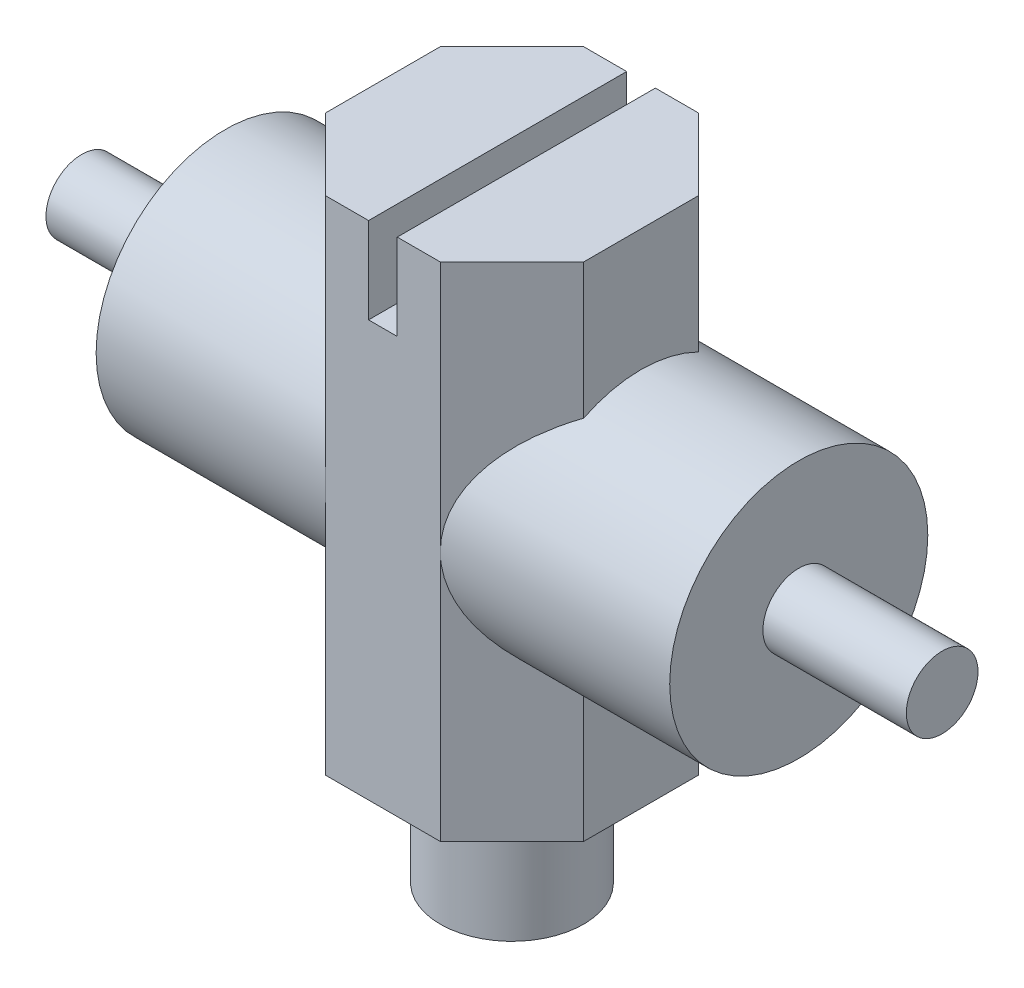
from build123d import *

# Parameters (mm, degrees)
SKETCH4_W           = 180
SKETCH4_H           = 180
BOSS_EXTRUDE2_DEPTH = 175
SKETCH5_R           = 50
BOSS_EXTRUDE3_DEPTH = 90
CHAMFER1_SIZE       = 50
SKETCH6_W           = 20
SKETCH6_H           = 180
CUT_EXTRUDE1_DEPTH  = 60


with BuildPart() as part:
    # Sketch3 → Revolve1 (revolve)
    with BuildSketch(Plane.XY, mode=Mode.PRIVATE) as revolve1_sk:
        Polygon((0, 0), (0, 25), (100, 25), (100, 90), (500, 90), (500, 25), (600, 25), (600, 0), align=None)
    revolve(revolve1_sk.sketch.rotate(Axis((0, 0, 0), (-1, 0, 0)), 90), axis=Axis((0, 0, 0), (-1, 0, 0)))

    # Sketch4 → Boss-Extrude2 (add, symmetric)
    with BuildSketch(Plane(origin=(0, 0, 0), x_dir=(1, 0, 0), z_dir=(0, 1, 0))):
        with Locations((300, 0)):
            Rectangle(SKETCH4_W, SKETCH4_H)
    extrude(amount=BOSS_EXTRUDE2_DEPTH, both=True)

    # Sketch5 → Boss-Extrude3 (add)
    with BuildSketch(Plane.XZ.offset(175)):
        with Locations(Location((300, 0, 0), (0, 0, 90))):
            Circle(SKETCH5_R)
    extrude(amount=BOSS_EXTRUDE3_DEPTH)

    # Chamfer1
    # the kernel refuses this chamfer: 50 mm, written as the material it takes off along each edge
    with BuildSketch(Plane(origin=(210, -303.584149398, -90), x_dir=(-0.027495876610586594, 0, 0.9996219169112966), z_dir=(0, 1, 0))) as chamfer1_piece_1_section:
        Polygon((CHAMFER1_SIZE * 0.999621916911, CHAMFER1_SIZE * 0.0274958766106), (-CHAMFER1_SIZE * 0.0274958766106, CHAMFER1_SIZE * 0.999621916911), (0, 0), align=None)
    chamfer1_piece_1 = extrude(amount=303.584149398, mode=Mode.PRIVATE)
    chamfer1_piece_1 = chamfer1_piece_1 - Plane(origin=(227.472268945, 0, 0), x_dir=(0, 0, -1), z_dir=(1, 0, 0)) * Cylinder(90, 808, mode=Mode.PRIVATE)
    add(chamfer1_piece_1, mode=Mode.SUBTRACT)
    with BuildSketch(Plane(origin=(210, -303.584149398, 90), x_dir=(-0.027495876610586598, 0, -0.9996219169112966), z_dir=(0, 1, 0))) as chamfer1_piece_2_section:
        Polygon((CHAMFER1_SIZE * 0.999621916911, -CHAMFER1_SIZE * 0.0274958766106), (-CHAMFER1_SIZE * 0.0274958766106, -CHAMFER1_SIZE * 0.999621916911), (0, 0), align=None)
    chamfer1_piece_2 = extrude(amount=303.584149398, mode=Mode.PRIVATE)
    chamfer1_piece_2 = chamfer1_piece_2 - Plane(origin=(227.472268938, 0, 0), x_dir=(0, 0, -1), z_dir=(1, 0, 0)) * Cylinder(90, 808, mode=Mode.PRIVATE)
    add(chamfer1_piece_2, mode=Mode.SUBTRACT)
    with BuildSketch(Plane(origin=(390, 0, 90), x_dir=(-0.9996219169112966, 0, 0.02749587661058631), z_dir=(0, -1, 0))) as chamfer1_piece_3_section:
        Polygon((CHAMFER1_SIZE * 0.999621916911, CHAMFER1_SIZE * 0.0274958766106), (-CHAMFER1_SIZE * 0.0274958766106, CHAMFER1_SIZE * 0.999621916911), (0, 0), align=None)
    chamfer1_piece_3 = extrude(amount=303.584149398, mode=Mode.PRIVATE)
    chamfer1_piece_3 = chamfer1_piece_3 - Plane(origin=(372.527731062, 0, 0), x_dir=(0, 0, -1), z_dir=(1, 0, 0)) * Cylinder(90, 808, mode=Mode.PRIVATE)
    add(chamfer1_piece_3, mode=Mode.SUBTRACT)
    with BuildSketch(Plane(origin=(390, 303.584149398, -90), x_dir=(-0.9996219169112966, 0, -0.02749587661058631), z_dir=(0, -1, 0))) as chamfer1_piece_4_section:
        Polygon((CHAMFER1_SIZE * 0.999621916911, -CHAMFER1_SIZE * 0.0274958766106), (-CHAMFER1_SIZE * 0.0274958766106, -CHAMFER1_SIZE * 0.999621916911), (0, 0), align=None)
    chamfer1_piece_4 = extrude(amount=303.584149398, mode=Mode.PRIVATE)
    chamfer1_piece_4 = chamfer1_piece_4 - Plane(origin=(372.527731055, 0, 0), x_dir=(0, 0, -1), z_dir=(1, 0, 0)) * Cylinder(90, 808, mode=Mode.PRIVATE)
    add(chamfer1_piece_4, mode=Mode.SUBTRACT)
    with BuildSketch(Plane(origin=(210, 0, -90), x_dir=(-0.027495876610586594, 0, 0.9996219169112966), z_dir=(0, 1, 0))) as chamfer1_piece_5_section:
        Polygon((CHAMFER1_SIZE * 0.999621916911, CHAMFER1_SIZE * 0.0274958766106), (-CHAMFER1_SIZE * 0.0274958766106, CHAMFER1_SIZE * 0.999621916911), (0, 0), align=None)
    chamfer1_piece_5 = extrude(amount=303.584149398, mode=Mode.PRIVATE)
    chamfer1_piece_5 = chamfer1_piece_5 - Plane(origin=(227.472268945, 0, 0), x_dir=(0, 0, -1), z_dir=(1, 0, 0)) * Cylinder(90, 808, mode=Mode.PRIVATE)
    add(chamfer1_piece_5, mode=Mode.SUBTRACT)
    with BuildSketch(Plane(origin=(210, 0, 90), x_dir=(-0.027495876610586598, 0, -0.9996219169112966), z_dir=(0, 1, 0))) as chamfer1_piece_6_section:
        Polygon((CHAMFER1_SIZE * 0.999621916911, -CHAMFER1_SIZE * 0.0274958766106), (-CHAMFER1_SIZE * 0.0274958766106, -CHAMFER1_SIZE * 0.999621916911), (0, 0), align=None)
    chamfer1_piece_6 = extrude(amount=303.584149398, mode=Mode.PRIVATE)
    chamfer1_piece_6 = chamfer1_piece_6 - Plane(origin=(227.472268947, 0, 0), x_dir=(0, 0, -1), z_dir=(1, 0, 0)) * Cylinder(90, 808, mode=Mode.PRIVATE)
    add(chamfer1_piece_6, mode=Mode.SUBTRACT)
    with BuildSketch(Plane(origin=(390, 303.584149398, 90), x_dir=(-0.9996219169112966, 0, 0.02749587661058631), z_dir=(0, -1, 0))) as chamfer1_piece_7_section:
        Polygon((CHAMFER1_SIZE * 0.999621916911, CHAMFER1_SIZE * 0.0274958766106), (-CHAMFER1_SIZE * 0.0274958766106, CHAMFER1_SIZE * 0.999621916911), (0, 0), align=None)
    chamfer1_piece_7 = extrude(amount=303.584149398, mode=Mode.PRIVATE)
    chamfer1_piece_7 = chamfer1_piece_7 - Plane(origin=(372.527731053, 0, 0), x_dir=(0, 0, -1), z_dir=(1, 0, 0)) * Cylinder(90, 808, mode=Mode.PRIVATE)
    add(chamfer1_piece_7, mode=Mode.SUBTRACT)
    with BuildSketch(Plane(origin=(390, 0, -90), x_dir=(-0.9996219169112966, 0, -0.02749587661058631), z_dir=(0, -1, 0))) as chamfer1_piece_8_section:
        Polygon((CHAMFER1_SIZE * 0.999621916911, -CHAMFER1_SIZE * 0.0274958766106), (-CHAMFER1_SIZE * 0.0274958766106, -CHAMFER1_SIZE * 0.999621916911), (0, 0), align=None)
    chamfer1_piece_8 = extrude(amount=303.584149398, mode=Mode.PRIVATE)
    chamfer1_piece_8 = chamfer1_piece_8 - Plane(origin=(372.527731055, 0, 0), x_dir=(0, 0, -1), z_dir=(1, 0, 0)) * Cylinder(90, 808, mode=Mode.PRIVATE)
    add(chamfer1_piece_8, mode=Mode.SUBTRACT)

    # Sketch6 → Cut-Extrude1 (cut)
    with BuildSketch(Plane(origin=(0, 175, 0), x_dir=(1, 0, 0), z_dir=(0, 1, 0))):
        with Locations((300, 0)):
            Rectangle(SKETCH6_W, SKETCH6_H)
    extrude(amount=-CUT_EXTRUDE1_DEPTH, mode=Mode.SUBTRACT)


solid = part.part
